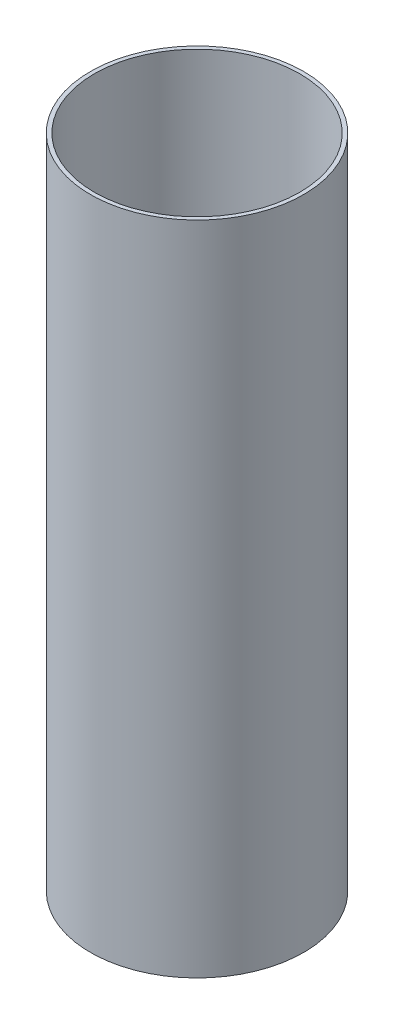
from build123d import *

# Parameters (mm, degrees)
SKETCH1_R           = 49.5173
SKETCH1_R_2         = 47.6885
BOSS_EXTRUDE1_DEPTH = 304.8


with BuildPart() as part:
    # Sketch1 → Boss-Extrude1 (new body)
    with BuildSketch(Plane(origin=(0, 0, 0), x_dir=(1, 0, 0), z_dir=(0, 1, 0))):
        Circle(SKETCH1_R)
        Circle(SKETCH1_R_2, mode=Mode.SUBTRACT)
    extrude(amount=BOSS_EXTRUDE1_DEPTH)


solid = part.part
